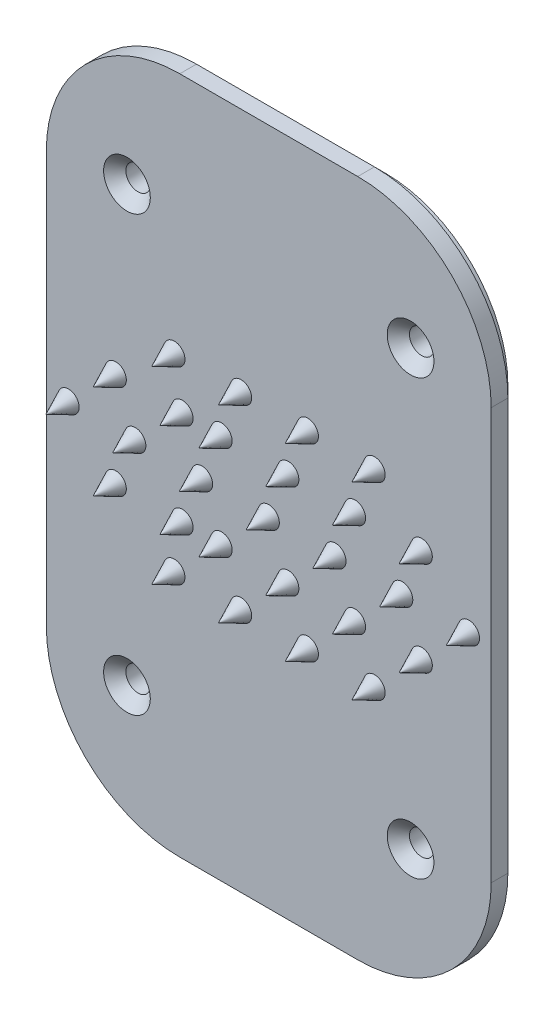
from build123d import *
from OCP.BRepFilletAPI import BRepFilletAPI_MakeChamfer

# Parameters (mm, degrees)
SKETCH_3_R       = 2.1
EXTRUDE_1_DEPTH  = 1
SKETCH_5_R       = 1.1
EXTRUDE_3_DEPTH  = 1
SKETCH_7_R       = 1.1
EXTRUDE_4_DEPTH  = 1.5
CHAMFER_1_SIZE   = 1
SKETCH_8_R       = 0.951166171
EXTRUDE_5_DEPTH  = 2
CHAMFER_2_SIZE   = 2
CHAMFER_2_SIZE_2 = 0.932615316


with BuildPart() as part:
    # 草图3 → 凸台-拉伸1 (new body)
    with BuildSketch(Plane.XY):
        with BuildLine():
            Line((7, 28.5), (-7, 28.5))
            ThreePointArc((-7, 28.5), (-14.778174593, 25.278174593), (-18, 17.5))
            Line((-18, 17.5), (-18, -17.5))
            ThreePointArc((-18, -17.5), (-14.778174593, -25.278174593), (-7, -28.5))
            Line((-7, -28.5), (7, -28.5))
            ThreePointArc((7, -28.5), (14.778174593, -25.278174593), (18, -17.5))
            Line((18, -17.5), (18, 17.5))
            ThreePointArc((18, 17.5), (14.778174593, 25.278174593), (7, 28.5))
        make_face()
        with Locations((-12.75, 19.525931249)):
            Circle(SKETCH_3_R, mode=Mode.SUBTRACT)
        with Locations((12.75, 19.525931249)):
            Circle(SKETCH_3_R, mode=Mode.SUBTRACT)
        with Locations((12.75, -19.5)):
            Circle(SKETCH_3_R, mode=Mode.SUBTRACT)
        with Locations((-12.75, -19.5)):
            Circle(SKETCH_3_R, mode=Mode.SUBTRACT)
    extrude(amount=EXTRUDE_1_DEPTH)

    # 草图5 → 凸台-拉伸3 (add)
    with BuildSketch(Plane.XY.offset(1)):
        with BuildLine():
            Line((19, 17.5), (19, -17.5))
            ThreePointArc((19, -17.5), (15.485281374, -25.985281374), (7, -29.5))
            Line((7, -29.5), (-7, -29.5))
            ThreePointArc((-7, -29.5), (-15.485281374, -25.985281374), (-19, -17.5))
            Line((-19, -17.5), (-19, 17.5))
            ThreePointArc((-19, 17.5), (-15.485281374, 25.985281374), (-7, 29.5))
            Line((-7, 29.5), (7, 29.5))
            ThreePointArc((7, 29.5), (15.485281374, 25.985281374), (19, 17.5))
        make_face()
        with Locations((-12.75, 19.525931249)):
            Circle(SKETCH_5_R, mode=Mode.SUBTRACT)
        with Locations((12.75, 19.525931249)):
            Circle(SKETCH_5_R, mode=Mode.SUBTRACT)
        with Locations((12.75, -19.5)):
            Circle(SKETCH_5_R, mode=Mode.SUBTRACT)
        with Locations((-12.75, -19.5)):
            Circle(SKETCH_5_R, mode=Mode.SUBTRACT)
    extrude(amount=EXTRUDE_3_DEPTH)

    # 草图7 → 凸台-拉伸4 (add)
    with BuildSketch(Plane.XY.offset(2)):
        with BuildLine():
            Line((-8, 30.5), (8, 30.5))
            ThreePointArc((8, 30.5), (16.485281374, 26.985281374), (20, 18.5))
            Line((20, 18.5), (20, -18.5))
            ThreePointArc((20, -18.5), (16.485281374, -26.985281374), (8, -30.5))
            Line((8, -30.5), (-8, -30.5))
            ThreePointArc((-8, -30.5), (-16.485281374, -26.985281374), (-20, -18.5))
            Line((-20, -18.5), (-20, 18.5))
            ThreePointArc((-20, 18.5), (-16.485281374, 26.985281374), (-8, 30.5))
        make_face()
        with Locations((-12.75, 19.525931249)):
            Circle(SKETCH_7_R, mode=Mode.SUBTRACT)
        with Locations((12.75, 19.525931249)):
            Circle(SKETCH_7_R, mode=Mode.SUBTRACT)
        with Locations((12.75, -19.5)):
            Circle(SKETCH_7_R, mode=Mode.SUBTRACT)
        with Locations((-12.75, -19.5)):
            Circle(SKETCH_7_R, mode=Mode.SUBTRACT)
    extrude(amount=EXTRUDE_4_DEPTH)

    # 倒角1
    chamfer_1_edges = [part.edges().sort_by_distance(p)[0] for p in [
        (-13.85, 19.525931249, 3.5),
        (11.65, 19.525931249, 3.5),
        (11.65, -19.5, 3.5),
        (-13.85, -19.5, 3.5),
    ]]
    chamfer(chamfer_1_edges, length=CHAMFER_1_SIZE)

    # 草图8 → 凸台-拉伸5 (add)
    with BuildSketch(Plane.XY.offset(3.5)):
        Circle(SKETCH_8_R)
        with Locations((6, 0)):
            Circle(SKETCH_8_R)
        with Locations((12, 0)):
            Circle(SKETCH_8_R)
        with Locations((18, 0)):
            Circle(SKETCH_8_R)
        with Locations((1.757359313, 4.242640687)):
            Circle(SKETCH_8_R)
        with Locations((7.757359313, 4.242640687)):
            Circle(SKETCH_8_R)
        with Locations((13.757359313, 4.242640687)):
            Circle(SKETCH_8_R)
        with Locations((-2.485281374, 8.485281374)):
            Circle(SKETCH_8_R)
        with Locations((3.514718626, 8.485281374)):
            Circle(SKETCH_8_R)
        with Locations((9.514718626, 8.485281374)):
            Circle(SKETCH_8_R)
        with Locations((-4.242640687, 4.242640687)):
            Circle(SKETCH_8_R)
        with Locations((-8.485281374, 8.485281374)):
            Circle(SKETCH_8_R)
        with Locations(Location((-8.485281374, -8.485281374, 0), (0, 0, 180))):
            Circle(SKETCH_8_R)
        with Locations(Location((-4.242640687, -4.242640687, 0), (0, 0, 180))):
            Circle(SKETCH_8_R)
        with Locations(Location((9.514718626, -8.485281374, 0), (0, 0, 180))):
            Circle(SKETCH_8_R)
        with Locations(Location((3.514718626, -8.485281374, 0), (0, 0, 180))):
            Circle(SKETCH_8_R)
        with Locations(Location((-2.485281374, -8.485281374, 0), (0, 0, 180))):
            Circle(SKETCH_8_R)
        with Locations(Location((13.757359313, -4.242640687, 0), (0, 0, 180))):
            Circle(SKETCH_8_R)
        with Locations(Location((7.757359313, -4.242640687, 0), (0, 0, 180))):
            Circle(SKETCH_8_R)
        with Locations(Location((1.757359313, -4.242640687, 0), (0, 0, 180))):
            Circle(SKETCH_8_R)
        with Locations((-7.757359313, -4.242640687)):
            Circle(SKETCH_8_R)
        with Locations(Location((-7.757359313, 4.242640687, 0), (0, 0, 180))):
            Circle(SKETCH_8_R)
        with Locations(Location((-6, 0, 0), (0, 0, 180))):
            Circle(SKETCH_8_R)
        with Locations((-13.757359313, -4.242640687)):
            Circle(SKETCH_8_R)
        with Locations(Location((-13.757359313, 4.242640687, 0), (0, 0, 180))):
            Circle(SKETCH_8_R)
        with Locations(Location((-18, 0, 0), (0, 0, 180))):
            Circle(SKETCH_8_R)
        with Locations(Location((-12, 0, 0), (0, 0, 180))):
            Circle(SKETCH_8_R)
    extrude(amount=EXTRUDE_5_DEPTH)

    # 倒角2
    chamfer_2_edges_1 = [part.edges().sort_by_distance(p)[0] for p in [
        (-0.951166171, 0, 5.5),
    ]]
    chamfer_2_side_1 = [part.faces().sort_by_distance(p)[0] for p in [
        (-0.951166171, 0, 5.481347694),
    ]]
    chamfer_2_edges_2 = [part.edges().sort_by_distance(p)[0] for p in [
        (5.048833829, 0, 5.5),
    ]]
    chamfer_2_side_2 = [part.faces().sort_by_distance(p)[0] for p in [
        (5.048833829, 0, 5.481347694),
    ]]
    chamfer_2_edges_3 = [part.edges().sort_by_distance(p)[0] for p in [
        (11.048833829, 0, 5.5),
    ]]
    chamfer_2_side_3 = [part.faces().sort_by_distance(p)[0] for p in [
        (11.048833829, 0, 5.481347694),
    ]]
    chamfer_2_edges_4 = [part.edges().sort_by_distance(p)[0] for p in [
        (17.048833829, 0, 5.5),
    ]]
    chamfer_2_side_4 = [part.faces().sort_by_distance(p)[0] for p in [
        (17.048833829, 0, 5.481347694),
    ]]
    chamfer_2_edges_5 = [part.edges().sort_by_distance(p)[0] for p in [
        (0.806193142, 4.242640687, 5.5),
    ]]
    chamfer_2_side_5 = [part.faces().sort_by_distance(p)[0] for p in [
        (0.806193142, 4.242640687, 5.481347694),
    ]]
    chamfer_2_edges_6 = [part.edges().sort_by_distance(p)[0] for p in [
        (6.806193142, 4.242640687, 5.5),
    ]]
    chamfer_2_side_6 = [part.faces().sort_by_distance(p)[0] for p in [
        (6.806193142, 4.242640687, 5.481347694),
    ]]
    chamfer_2_edges_7 = [part.edges().sort_by_distance(p)[0] for p in [
        (12.806193142, 4.242640687, 5.5),
    ]]
    chamfer_2_side_7 = [part.faces().sort_by_distance(p)[0] for p in [
        (12.806193142, 4.242640687, 5.481347694),
    ]]
    chamfer_2_edges_8 = [part.edges().sort_by_distance(p)[0] for p in [
        (-3.436447545, 8.485281374, 5.5),
    ]]
    chamfer_2_side_8 = [part.faces().sort_by_distance(p)[0] for p in [
        (-3.436447545, 8.485281374, 5.481347694),
    ]]
    chamfer_2_edges_9 = [part.edges().sort_by_distance(p)[0] for p in [
        (2.563552455, 8.485281374, 5.5),
    ]]
    chamfer_2_side_9 = [part.faces().sort_by_distance(p)[0] for p in [
        (2.563552455, 8.485281374, 5.481347694),
    ]]
    chamfer_2_edges_10 = [part.edges().sort_by_distance(p)[0] for p in [
        (8.563552455, 8.485281374, 5.5),
    ]]
    chamfer_2_side_10 = [part.faces().sort_by_distance(p)[0] for p in [
        (8.563552455, 8.485281374, 5.481347694),
    ]]
    chamfer_2_edges_11 = [part.edges().sort_by_distance(p)[0] for p in [
        (-5.193806858, 4.242640687, 5.5),
    ]]
    chamfer_2_side_11 = [part.faces().sort_by_distance(p)[0] for p in [
        (-5.193806858, 4.242640687, 5.481347694),
    ]]
    chamfer_2_edges_12 = [part.edges().sort_by_distance(p)[0] for p in [
        (-9.436447545, 8.485281374, 5.5),
    ]]
    chamfer_2_side_12 = [part.faces().sort_by_distance(p)[0] for p in [
        (-9.436447545, 8.485281374, 5.481347694),
    ]]
    chamfer_2_edges_13 = [part.edges().sort_by_distance(p)[0] for p in [
        (-7.534115204, -8.485281374, 5.5),
    ]]
    chamfer_2_side_13 = [part.faces().sort_by_distance(p)[0] for p in [
        (-7.534115204, -8.485281374, 5.481347694),
    ]]
    chamfer_2_edges_14 = [part.edges().sort_by_distance(p)[0] for p in [
        (-3.291474516, -4.242640687, 5.5),
    ]]
    chamfer_2_side_14 = [part.faces().sort_by_distance(p)[0] for p in [
        (-3.291474516, -4.242640687, 5.481347694),
    ]]
    chamfer_2_edges_15 = [part.edges().sort_by_distance(p)[0] for p in [
        (10.465884796, -8.485281374, 5.5),
    ]]
    chamfer_2_side_15 = [part.faces().sort_by_distance(p)[0] for p in [
        (10.465884796, -8.485281374, 5.481347694),
    ]]
    chamfer_2_edges_16 = [part.edges().sort_by_distance(p)[0] for p in [
        (4.465884796, -8.485281374, 5.5),
    ]]
    chamfer_2_side_16 = [part.faces().sort_by_distance(p)[0] for p in [
        (4.465884796, -8.485281374, 5.481347694),
    ]]
    chamfer_2_edges_17 = [part.edges().sort_by_distance(p)[0] for p in [
        (-1.534115204, -8.485281374, 5.5),
    ]]
    chamfer_2_side_17 = [part.faces().sort_by_distance(p)[0] for p in [
        (-1.534115204, -8.485281374, 5.481347694),
    ]]
    chamfer_2_edges_18 = [part.edges().sort_by_distance(p)[0] for p in [
        (14.708525484, -4.242640687, 5.5),
    ]]
    chamfer_2_side_18 = [part.faces().sort_by_distance(p)[0] for p in [
        (14.708525484, -4.242640687, 5.481347694),
    ]]
    chamfer_2_edges_19 = [part.edges().sort_by_distance(p)[0] for p in [
        (8.708525484, -4.242640687, 5.5),
    ]]
    chamfer_2_side_19 = [part.faces().sort_by_distance(p)[0] for p in [
        (8.708525484, -4.242640687, 5.481347694),
    ]]
    chamfer_2_edges_20 = [part.edges().sort_by_distance(p)[0] for p in [
        (2.708525484, -4.242640687, 5.5),
    ]]
    chamfer_2_side_20 = [part.faces().sort_by_distance(p)[0] for p in [
        (2.708525484, -4.242640687, 5.481347694),
    ]]
    chamfer_2_edges_21 = [part.edges().sort_by_distance(p)[0] for p in [
        (-8.708525484, -4.242640687, 5.5),
    ]]
    chamfer_2_side_21 = [part.faces().sort_by_distance(p)[0] for p in [
        (-8.708525484, -4.242640687, 5.481347694),
    ]]
    chamfer_2_edges_22 = [part.edges().sort_by_distance(p)[0] for p in [
        (-6.806193142, 4.242640687, 5.5),
    ]]
    chamfer_2_side_22 = [part.faces().sort_by_distance(p)[0] for p in [
        (-6.806193142, 4.242640687, 5.481347694),
    ]]
    chamfer_2_edges_23 = [part.edges().sort_by_distance(p)[0] for p in [
        (-5.048833829, 0, 5.5),
    ]]
    chamfer_2_side_23 = [part.faces().sort_by_distance(p)[0] for p in [
        (-5.048833829, 0, 5.481347694),
    ]]
    chamfer_2_edges_24 = [part.edges().sort_by_distance(p)[0] for p in [
        (-14.708525484, -4.242640687, 5.5),
    ]]
    chamfer_2_side_24 = [part.faces().sort_by_distance(p)[0] for p in [
        (-14.708525484, -4.242640687, 5.481347694),
    ]]
    chamfer_2_edges_25 = [part.edges().sort_by_distance(p)[0] for p in [
        (-12.806193142, 4.242640687, 5.5),
    ]]
    chamfer_2_side_25 = [part.faces().sort_by_distance(p)[0] for p in [
        (-12.806193142, 4.242640687, 5.481347694),
    ]]
    chamfer_2_edges_26 = [part.edges().sort_by_distance(p)[0] for p in [
        (-17.048833829, 0, 5.5),
    ]]
    chamfer_2_side_26 = [part.faces().sort_by_distance(p)[0] for p in [
        (-17.048833829, 0, 5.481347694),
    ]]
    chamfer_2_edges_27 = [part.edges().sort_by_distance(p)[0] for p in [
        (-11.048833829, 0, 5.5),
    ]]
    chamfer_2_side_27 = [part.faces().sort_by_distance(p)[0] for p in [
        (-11.048833829, 0, 5.481347694),
    ]]
    chamfer_2 = BRepFilletAPI_MakeChamfer(part.part.solid().wrapped)
    for e in chamfer_2_edges_1:
        chamfer_2.Add(CHAMFER_2_SIZE - 0.0001, CHAMFER_2_SIZE_2 - 0.0001, e.wrapped, chamfer_2_side_1[0].wrapped)
    for e in chamfer_2_edges_2:
        chamfer_2.Add(CHAMFER_2_SIZE - 0.0001, CHAMFER_2_SIZE_2 - 0.0001, e.wrapped, chamfer_2_side_2[0].wrapped)
    for e in chamfer_2_edges_3:
        chamfer_2.Add(CHAMFER_2_SIZE - 0.0001, CHAMFER_2_SIZE_2 - 0.0001, e.wrapped, chamfer_2_side_3[0].wrapped)
    for e in chamfer_2_edges_4:
        chamfer_2.Add(CHAMFER_2_SIZE - 0.0001, CHAMFER_2_SIZE_2 - 0.0001, e.wrapped, chamfer_2_side_4[0].wrapped)
    for e in chamfer_2_edges_5:
        chamfer_2.Add(CHAMFER_2_SIZE - 0.0001, CHAMFER_2_SIZE_2 - 0.0001, e.wrapped, chamfer_2_side_5[0].wrapped)
    for e in chamfer_2_edges_6:
        chamfer_2.Add(CHAMFER_2_SIZE - 0.0001, CHAMFER_2_SIZE_2 - 0.0001, e.wrapped, chamfer_2_side_6[0].wrapped)
    for e in chamfer_2_edges_7:
        chamfer_2.Add(CHAMFER_2_SIZE - 0.0001, CHAMFER_2_SIZE_2 - 0.0001, e.wrapped, chamfer_2_side_7[0].wrapped)
    for e in chamfer_2_edges_8:
        chamfer_2.Add(CHAMFER_2_SIZE - 0.0001, CHAMFER_2_SIZE_2 - 0.0001, e.wrapped, chamfer_2_side_8[0].wrapped)
    for e in chamfer_2_edges_9:
        chamfer_2.Add(CHAMFER_2_SIZE - 0.0001, CHAMFER_2_SIZE_2 - 0.0001, e.wrapped, chamfer_2_side_9[0].wrapped)
    for e in chamfer_2_edges_10:
        chamfer_2.Add(CHAMFER_2_SIZE - 0.0001, CHAMFER_2_SIZE_2 - 0.0001, e.wrapped, chamfer_2_side_10[0].wrapped)
    for e in chamfer_2_edges_11:
        chamfer_2.Add(CHAMFER_2_SIZE - 0.0001, CHAMFER_2_SIZE_2 - 0.0001, e.wrapped, chamfer_2_side_11[0].wrapped)
    for e in chamfer_2_edges_12:
        chamfer_2.Add(CHAMFER_2_SIZE - 0.0001, CHAMFER_2_SIZE_2 - 0.0001, e.wrapped, chamfer_2_side_12[0].wrapped)
    for e in chamfer_2_edges_13:
        chamfer_2.Add(CHAMFER_2_SIZE - 0.0001, CHAMFER_2_SIZE_2 - 0.0001, e.wrapped, chamfer_2_side_13[0].wrapped)
    for e in chamfer_2_edges_14:
        chamfer_2.Add(CHAMFER_2_SIZE - 0.0001, CHAMFER_2_SIZE_2 - 0.0001, e.wrapped, chamfer_2_side_14[0].wrapped)
    for e in chamfer_2_edges_15:
        chamfer_2.Add(CHAMFER_2_SIZE - 0.0001, CHAMFER_2_SIZE_2 - 0.0001, e.wrapped, chamfer_2_side_15[0].wrapped)
    for e in chamfer_2_edges_16:
        chamfer_2.Add(CHAMFER_2_SIZE - 0.0001, CHAMFER_2_SIZE_2 - 0.0001, e.wrapped, chamfer_2_side_16[0].wrapped)
    for e in chamfer_2_edges_17:
        chamfer_2.Add(CHAMFER_2_SIZE - 0.0001, CHAMFER_2_SIZE_2 - 0.0001, e.wrapped, chamfer_2_side_17[0].wrapped)
    for e in chamfer_2_edges_18:
        chamfer_2.Add(CHAMFER_2_SIZE - 0.0001, CHAMFER_2_SIZE_2 - 0.0001, e.wrapped, chamfer_2_side_18[0].wrapped)
    for e in chamfer_2_edges_19:
        chamfer_2.Add(CHAMFER_2_SIZE - 0.0001, CHAMFER_2_SIZE_2 - 0.0001, e.wrapped, chamfer_2_side_19[0].wrapped)
    for e in chamfer_2_edges_20:
        chamfer_2.Add(CHAMFER_2_SIZE - 0.0001, CHAMFER_2_SIZE_2 - 0.0001, e.wrapped, chamfer_2_side_20[0].wrapped)
    for e in chamfer_2_edges_21:
        chamfer_2.Add(CHAMFER_2_SIZE - 0.0001, CHAMFER_2_SIZE_2 - 0.0001, e.wrapped, chamfer_2_side_21[0].wrapped)
    for e in chamfer_2_edges_22:
        chamfer_2.Add(CHAMFER_2_SIZE - 0.0001, CHAMFER_2_SIZE_2 - 0.0001, e.wrapped, chamfer_2_side_22[0].wrapped)
    for e in chamfer_2_edges_23:
        chamfer_2.Add(CHAMFER_2_SIZE - 0.0001, CHAMFER_2_SIZE_2 - 0.0001, e.wrapped, chamfer_2_side_23[0].wrapped)
    for e in chamfer_2_edges_24:
        chamfer_2.Add(CHAMFER_2_SIZE - 0.0001, CHAMFER_2_SIZE_2 - 0.0001, e.wrapped, chamfer_2_side_24[0].wrapped)
    for e in chamfer_2_edges_25:
        chamfer_2.Add(CHAMFER_2_SIZE - 0.0001, CHAMFER_2_SIZE_2 - 0.0001, e.wrapped, chamfer_2_side_25[0].wrapped)
    for e in chamfer_2_edges_26:
        chamfer_2.Add(CHAMFER_2_SIZE - 0.0001, CHAMFER_2_SIZE_2 - 0.0001, e.wrapped, chamfer_2_side_26[0].wrapped)
    for e in chamfer_2_edges_27:
        chamfer_2.Add(CHAMFER_2_SIZE - 0.0001, CHAMFER_2_SIZE_2 - 0.0001, e.wrapped, chamfer_2_side_27[0].wrapped)
    add(Compound.cast(chamfer_2.Shape()), mode=Mode.REPLACE)  # a hair under: the kernel refuses the full size


solid = part.part
